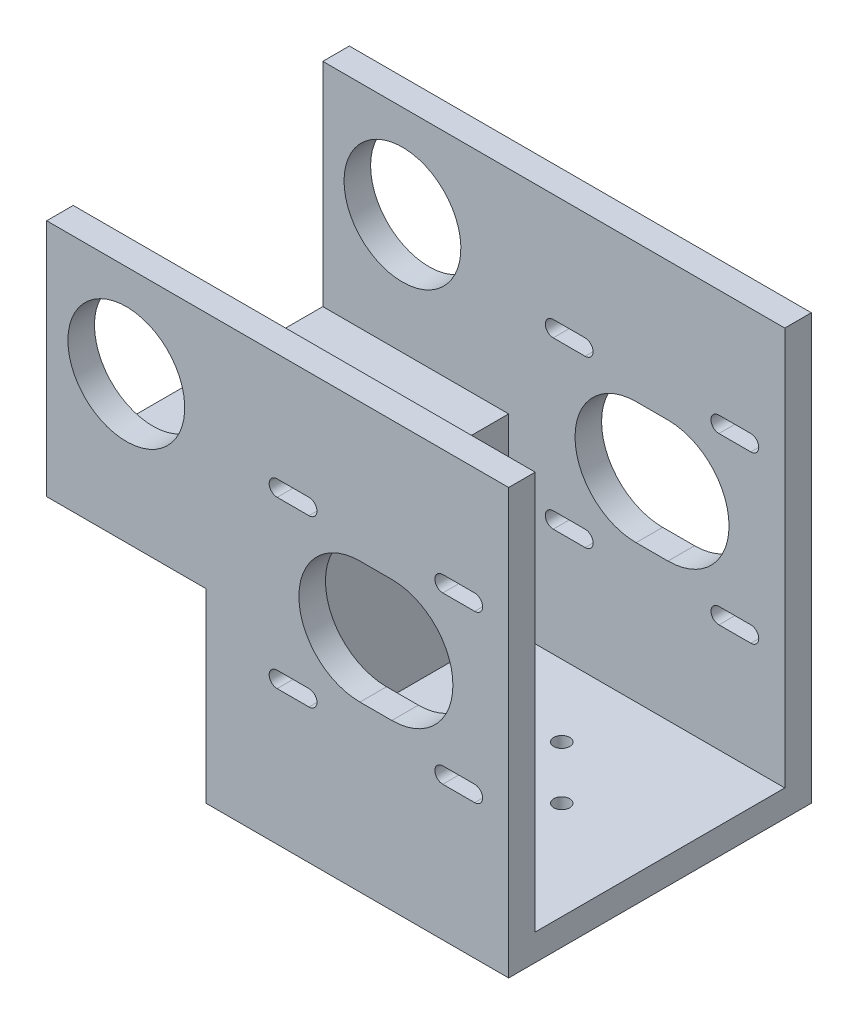
from build123d import *

# Parameters (mm, degrees)
SKETCH1_W           = 57
SKETCH1_H           = 57
BOSS_EXTRUDE1_DEPTH = 80
SKETCH3_W           = 75
SKETCH3_H           = 47
CUT_EXTRUDE1_DEPTH  = 52
SKETCH4_R           = 3.25
SKETCH4_R_2         = 1.5
CUT_EXTRUDE2_DEPTH  = 106.496445438
BOSS_EXTRUDE2_DEPTH = 30
CUT_EXTRUDE5_REACH  = 104.28
SKETCH8_W           = 47
SKETCH8_H           = 40
SKETCH5_R           = 11
CUT_EXTRUDE3_DEPTH  = 115.329567479


with BuildPart() as part:
    # Sketch1 → Boss-Extrude1 (new body)
    with BuildSketch(Plane(origin=(0, 0, 0), x_dir=(1, 0, 0), z_dir=(0, 1, 0))):
        Rectangle(SKETCH1_W, SKETCH1_H)
    extrude(amount=BOSS_EXTRUDE1_DEPTH)

    # Sketch3 → Cut-Extrude1 (cut)
    with BuildSketch(Plane(origin=(28.5, 40, 0), x_dir=(0, 1, 0), z_dir=(-1, 0, 0))):
        with Locations((2.5, 0)):
            Rectangle(SKETCH3_W, SKETCH3_H)
    extrude(amount=CUT_EXTRUDE1_DEPTH, mode=Mode.SUBTRACT)

    # Sketch4 → Cut-Extrude2 (cut, through all)
    with BuildSketch(Plane(origin=(-40, 5, 0), x_dir=(-1, 0, 0), z_dir=(0, -1, 0))):
        with Locations((-40, 0)):
            Circle(SKETCH4_R)
        with Locations((-40, 10)):
            Circle(SKETCH4_R_2)
        with Locations((-30, 0)):
            Circle(SKETCH4_R_2)
        with Locations((-40, -10)):
            Circle(SKETCH4_R_2)
        with Locations((-50, 0)):
            Circle(SKETCH4_R_2)
    extrude(amount=CUT_EXTRUDE2_DEPTH, mode=Mode.SUBTRACT)

    # Sketch7 → Boss-Extrude2 (add)
    with BuildSketch(Plane.ZY.offset(28.5)):
        Polygon((-28.5, 80), (-23.5, 80), (-23.5, 40), (23.5, 40), (23.5, 80), (28.5, 80), (28.5, 35), (-28.5, 35), align=None)
    extrude(amount=BOSS_EXTRUDE2_DEPTH)

    # Sketch8 → Cut-Extrude5 (cut, up to next)
    with BuildSketch(Plane.ZY.offset(28.5), mode=Mode.PRIVATE) as cut_extrude5_sk1:
        with Locations((0, 60)):
            Rectangle(SKETCH8_W, SKETCH8_H)
    cut_extrude5_tool1 = extrude(cut_extrude5_sk1.sketch, amount=-CUT_EXTRUDE5_REACH, mode=Mode.PRIVATE) & part.part
    add(cut_extrude5_tool1.solids().sort_by_distance((-28.5, 60, 0))[0], mode=Mode.SUBTRACT)

    # Sketch5 → Cut-Extrude3 (cut, through all)
    with BuildSketch(Plane(origin=(0, 0, -28.5), x_dir=(-1, 0, 0), z_dir=(0, 0, -1))):
        with Locations((43.5, 62.5)):
            Circle(SKETCH5_R)
        with BuildLine():
            Line((-22.1, 59.6), (-16.1, 59.6))
            ThreePointArc((-16.1, 59.6), (-14.6, 58.1), (-16.1, 56.6))
            Line((-16.1, 56.6), (-22.1, 56.6))
            ThreePointArc((-22.1, 56.6), (-23.6, 58.1), (-22.1, 59.6))
        make_face()
        with BuildLine():
            Line((-0.5, 31), (-6.5, 31))
            ThreePointArc((-6.5, 31), (-18, 42.5), (-6.5, 54))
            Line((-6.5, 54), (-0.5, 54))
            ThreePointArc((-0.5, 54), (11, 42.5), (-0.5, 31))
        make_face()
        with BuildLine():
            Line((-22.1, 25.4), (-16.1, 25.4))
            ThreePointArc((-16.1, 25.4), (-14.6, 26.9), (-16.1, 28.4))
            Line((-16.1, 28.4), (-22.1, 28.4))
            ThreePointArc((-22.1, 28.4), (-23.6, 26.9), (-22.1, 25.4))
        make_face()
        with BuildLine():
            Line((15.1, 25.4), (9.1, 25.4))
            ThreePointArc((9.1, 25.4), (7.6, 26.9), (9.1, 28.4))
            Line((9.1, 28.4), (15.1, 28.4))
            ThreePointArc((15.1, 28.4), (16.6, 26.9), (15.1, 25.4))
        make_face()
        with BuildLine():
            Line((15.1, 59.6), (9.1, 59.6))
            ThreePointArc((9.1, 59.6), (7.6, 58.1), (9.1, 56.6))
            Line((9.1, 56.6), (15.1, 56.6))
            ThreePointArc((15.1, 56.6), (16.6, 58.1), (15.1, 59.6))
        make_face()
    extrude(amount=-CUT_EXTRUDE3_DEPTH, mode=Mode.SUBTRACT)


solid = part.part
